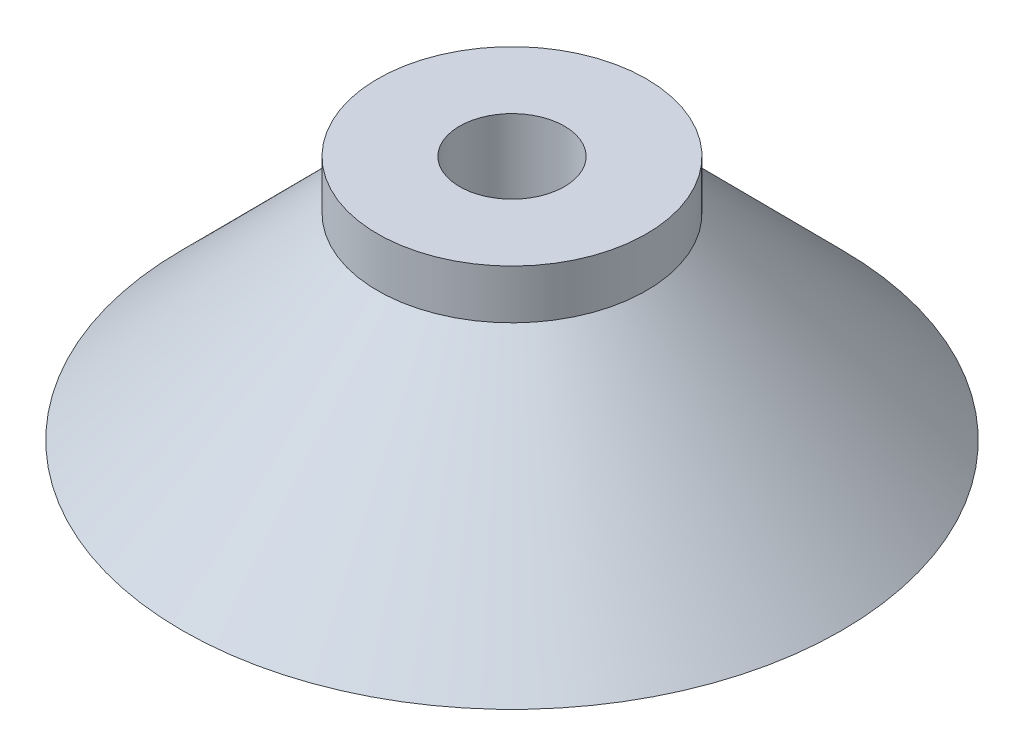
from build123d import *


with BuildPart() as part:
    # Sketch1 → Revolve1 (revolve)
    with BuildSketch(Plane(origin=(0, 0, 0), x_dir=(0, 0, -1), z_dir=(1, 0, 0))):
        Polygon((2.032, 0), (2.032, 9.525), (5.207, 9.525), (5.207, 7.62), (12.7762, 0), align=None)
    revolve(axis=Axis((0, 0, 0), (0, 1, 0)))


solid = part.part
